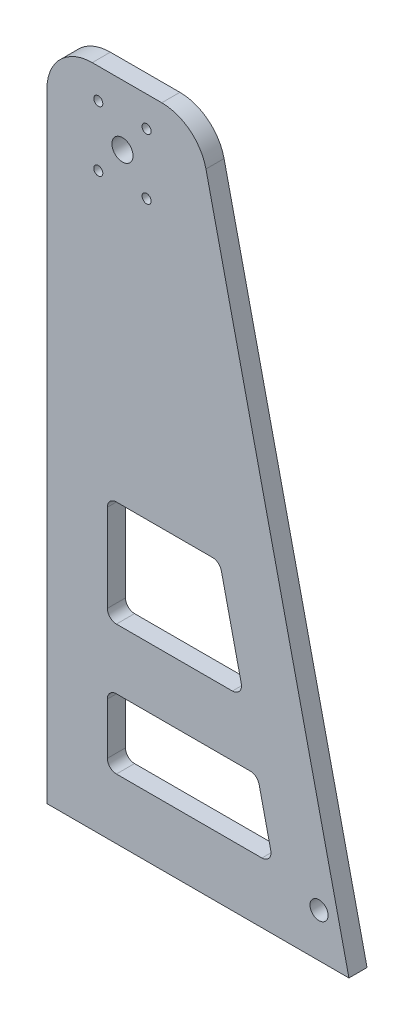
from build123d import *

# Parameters (mm, degrees)
ESBO_O1_R                = 1.5
ESBO_O1_R_2              = 3.5
RESSALTO_EXTRUS_O2_DEPTH = 6
FILETE1_R                = 15
ESBO_O2_R                = 3
CORTE_EXTRUS_O1_DEPTH    = 10


with BuildPart() as part:
    # Esboço1 → Ressalto-extrusão2 (new body)
    with BuildSketch(Plane.XY):
        Polygon((0, 0), (0, 220), (50, 220), (100, 0), align=None)
        with Locations((17, 210)):
            Circle(ESBO_O1_R, mode=Mode.SUBTRACT)
        with Locations((33, 210)):
            Circle(ESBO_O1_R, mode=Mode.SUBTRACT)
        with Locations((33, 190)):
            Circle(ESBO_O1_R, mode=Mode.SUBTRACT)
        with Locations((17, 190)):
            Circle(ESBO_O1_R, mode=Mode.SUBTRACT)
        with Locations((25, 200)):
            Circle(ESBO_O1_R_2, mode=Mode.SUBTRACT)
        with BuildLine():
            Line((20, 95), (20, 66))
            ThreePointArc((20, 66), (20.878679656, 63.878679656), (23, 63))
            Line((23, 63), (61.413470366, 63))
            ThreePointArc((61.413470366, 63), (63.75810146, 64.128448496), (64.338868934, 66.664863311))
            Line((64.338868934, 66.664863311), (57.747959843, 95.664863311))
            ThreePointArc((57.747959843, 95.664863311), (56.69411278, 97.344631094), (54.822561275, 98))
            Line((54.822561275, 98), (23, 98))
            ThreePointArc((23, 98), (20.878679656, 97.121320344), (20, 95))
        make_face(mode=Mode.SUBTRACT)
        with BuildLine():
            Line((20, 40), (20, 23))
            ThreePointArc((20, 23), (20.878679656, 20.878679656), (23, 20))
            Line((23, 20), (71.186197639, 20))
            ThreePointArc((71.186197639, 20), (73.530828733, 21.128448496), (74.111596206, 23.664863311))
            Line((74.111596206, 23.664863311), (70.247959843, 40.664863311))
            ThreePointArc((70.247959843, 40.664863311), (69.19411278, 42.344631094), (67.322561275, 43))
            Line((67.322561275, 43), (23, 43))
            ThreePointArc((23, 43), (20.878679656, 42.121320344), (20, 40))
        make_face(mode=Mode.SUBTRACT)
    extrude(amount=RESSALTO_EXTRUS_O2_DEPTH)

    # Filete1
    filete1_edges = [part.edges().sort_by_distance(p)[0] for p in [
        (0, 220, 3),
        (50, 220, 3),
    ]]
    fillet(filete1_edges, radius=FILETE1_R)

    # Esboço2 → Corte-extrusão1 (cut)
    with BuildSketch(Plane(origin=(0, 0, 0), x_dir=(-1, 0, 0), z_dir=(0, 0, -1))):
        with Locations((-90.096252795, 14.5)):
            Circle(ESBO_O2_R)
    extrude(amount=-CORTE_EXTRUS_O1_DEPTH, mode=Mode.SUBTRACT)


solid = part.part
